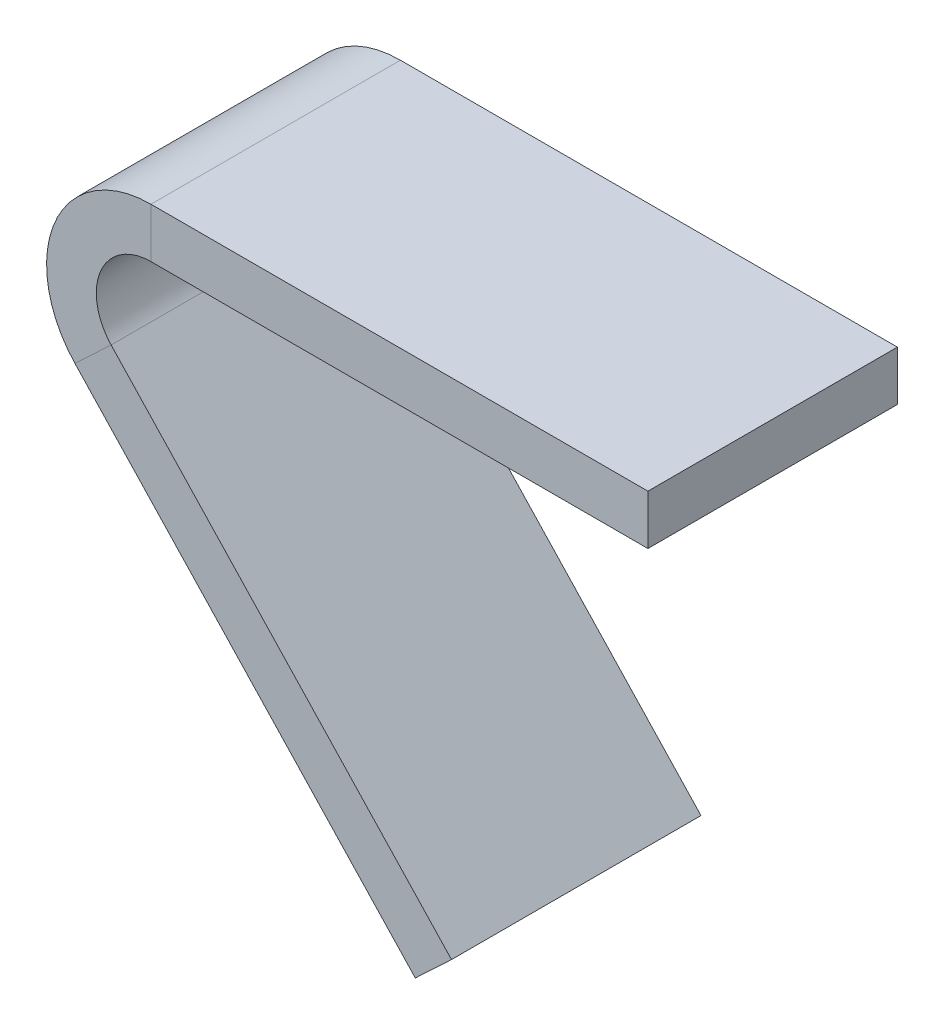
from build123d import *

# Parameters (mm, degrees)
BASE_FLANGE1_DEPTH = 15.9385


# Sheet-metal steps are written as plain solids
with BuildPart() as part:
    # Sketch2 → Base-Flange1 (new body)
    with BuildSketch(Plane.XY):
        with BuildLine():
            Line((27.278792287, -29.018500154), (5.531821011, -5.884613482))
            ThreePointArc((5.531821011, -5.884613482), (4.870870737, -2.106300174), (8.076491783, 0))
            Line((8.076491783, 0), (39.8272, 0))
            Line((39.8272, 0), (39.8272, 3.175))
            Line((39.8272, 3.175), (8.076491783, 3.175))
            ThreePointArc((8.076491783, 3.175), (1.956669786, -0.846118514), (3.218483945, -8.059262102))
            Line((3.218483945, -8.059262102), (24.965455221, -31.193148774))
            Line((24.965455221, -31.193148774), (27.278792287, -29.018500154))
        make_face()
    extrude(amount=BASE_FLANGE1_DEPTH)


solid = part.part
